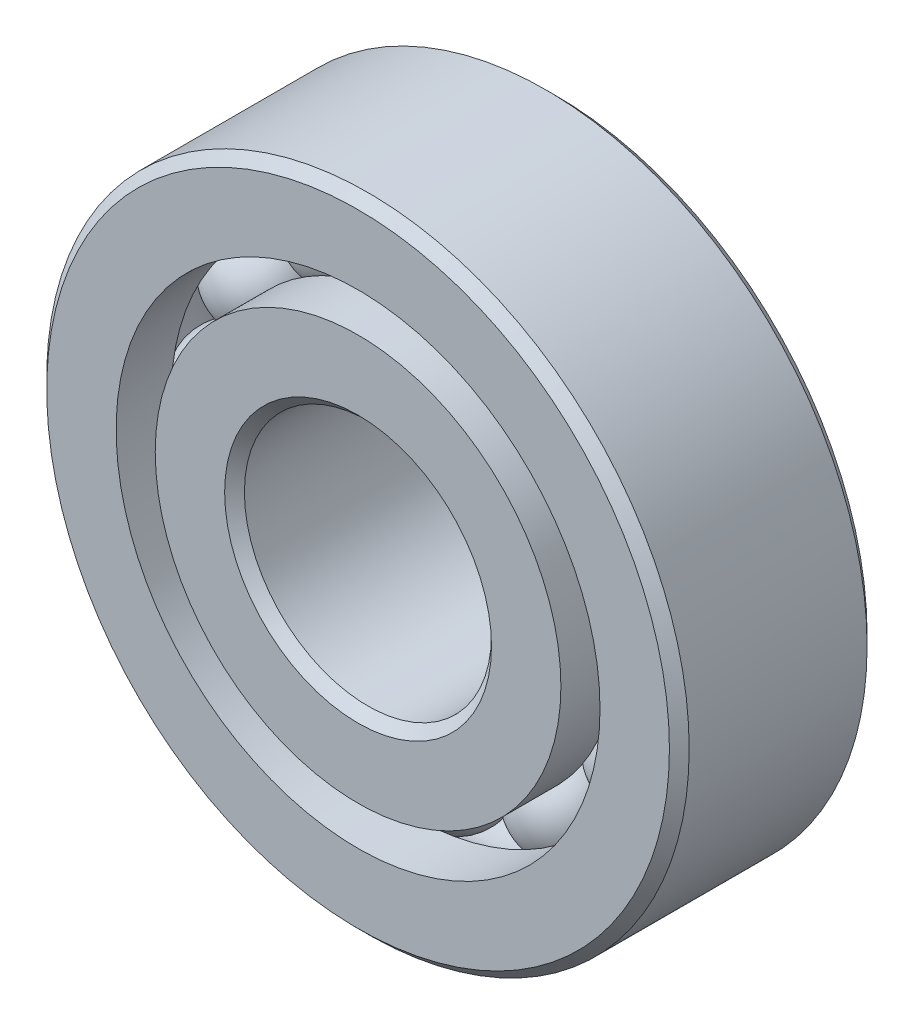
from build123d import *

# Parameters (mm, degrees)
CIRPATTERN1_COUNT = 12


with BuildPart() as part:
    # Sketch1 → Revolve1 (revolve)
    with BuildSketch(Plane(origin=(0, 0, 0), x_dir=(0, 0, -1), z_dir=(1, 0, 0))):
        with BuildLine():
            Line((3.6, 13), (-3.6, 13))
            Line((-3.6, 13), (-4, 12.6))
            Line((-4, 12.6), (-4, 9.791208791))
            Line((-4, 9.791208791), (-1.777777778, 9.791208791))
            ThreePointArc((-1.777777778, 9.791208791), (0, 10.945894442), (1.777777778, 9.791208791))
            Line((1.777777778, 9.791208791), (4, 9.791208791))
            Line((4, 9.791208791), (4, 12.6))
            Line((4, 12.6), (3.6, 13))
        make_face()
    revolve(axis=Axis((0, 0, 4), (0, 0, -1)))


with BuildPart() as body_2:
    # Sketch3 → Revolve3 (revolve)
    with BuildSketch(Plane(origin=(0, 0, 0), x_dir=(0, 0, -1), z_dir=(1, 0, 0))):
        with BuildLine():
            Line((-4, 8.208791209), (-1.777777778, 8.208791209))
            ThreePointArc((-1.777777778, 8.208791209), (0, 7.054105558), (1.777777778, 8.208791209))
            Line((1.777777778, 8.208791209), (4, 8.208791209))
            Line((4, 8.208791209), (4, 5.4))
            Line((4, 5.4), (3.6, 5))
            Line((3.6, 5), (-3.6, 5))
            Line((-3.6, 5), (-4, 5.4))
            Line((-4, 5.4), (-4, 8.208791209))
        make_face()
    revolve(axis=Axis((0, 0, 4), (0, 0, -1)))


with BuildPart() as body_3:
    # Sketch4 → Revolve4 (revolve)
    with BuildSketch(Plane(origin=(0, 0, 0), x_dir=(0, 0, -1), z_dir=(1, 0, 0))):
        with BuildLine():
            Line((-1.945894442, 9), (1.945894442, 9))
            ThreePointArc((1.945894442, 9), (0, 10.945894442), (-1.945894442, 9))
        make_face()
    revolve(axis=Axis((0, 9, 1.945894442), (0, 0, -1)))


with BuildPart() as cirpattern1_1:
    # CirPattern1: pattern copy
    add(body_3.part.rotate(Axis((0, 0, -4), (0, 0, 1)), 1 * 360 / CIRPATTERN1_COUNT))


with BuildPart() as cirpattern1_2:
    # CirPattern1: pattern copy
    add(body_3.part.rotate(Axis((0, 0, -4), (0, 0, 1)), 2 * 360 / CIRPATTERN1_COUNT))


with BuildPart() as cirpattern1_3:
    # CirPattern1: pattern copy
    add(body_3.part.rotate(Axis((0, 0, -4), (0, 0, 1)), 3 * 360 / CIRPATTERN1_COUNT))


with BuildPart() as cirpattern1_4:
    # CirPattern1: pattern copy
    add(body_3.part.rotate(Axis((0, 0, -4), (0, 0, 1)), 4 * 360 / CIRPATTERN1_COUNT))


with BuildPart() as cirpattern1_5:
    # CirPattern1: pattern copy
    add(body_3.part.rotate(Axis((0, 0, -4), (0, 0, 1)), 5 * 360 / CIRPATTERN1_COUNT))


with BuildPart() as cirpattern1_6:
    # CirPattern1: pattern copy
    add(body_3.part.rotate(Axis((0, 0, -4), (0, 0, 1)), 6 * 360 / CIRPATTERN1_COUNT))


with BuildPart() as cirpattern1_7:
    # CirPattern1: pattern copy
    add(body_3.part.rotate(Axis((0, 0, -4), (0, 0, 1)), 7 * 360 / CIRPATTERN1_COUNT))


with BuildPart() as cirpattern1_8:
    # CirPattern1: pattern copy
    add(body_3.part.rotate(Axis((0, 0, -4), (0, 0, 1)), 8 * 360 / CIRPATTERN1_COUNT))


with BuildPart() as cirpattern1_9:
    # CirPattern1: pattern copy
    add(body_3.part.rotate(Axis((0, 0, -4), (0, 0, 1)), 9 * 360 / CIRPATTERN1_COUNT))


with BuildPart() as cirpattern1_10:
    # CirPattern1: pattern copy
    add(body_3.part.rotate(Axis((0, 0, -4), (0, 0, 1)), 10 * 360 / CIRPATTERN1_COUNT))


with BuildPart() as cirpattern1_11:
    # CirPattern1: pattern copy
    add(body_3.part.rotate(Axis((0, 0, -4), (0, 0, 1)), 11 * 360 / CIRPATTERN1_COUNT))


solid = Compound([part.part, body_2.part, body_3.part, cirpattern1_1.part, cirpattern1_2.part, cirpattern1_3.part, cirpattern1_4.part, cirpattern1_5.part, cirpattern1_6.part, cirpattern1_7.part, cirpattern1_8.part, cirpattern1_9.part, cirpattern1_10.part, cirpattern1_11.part])
